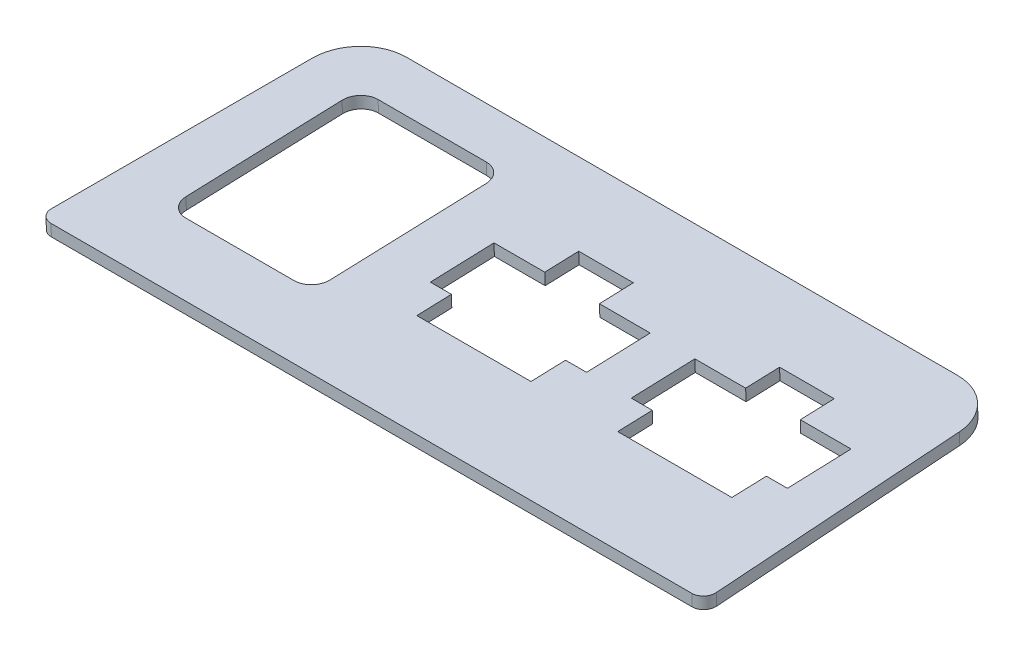
from build123d import *

# Parameters (mm, degrees)
BOSS_EXTRUDE1_DEPTH = 2
CUT_EXTRUDE1_REACH  = 75.082
FILLET1_R           = 2


with BuildPart() as part:
    # Sketch1 → Boss-Extrude1 (new body)
    with BuildSketch(Plane(origin=(0, -69.740385065, -2.435387911), x_dir=(1, 0, 0), z_dir=(0, 0.9993908270190958, 0.03489949670250105))):
        with BuildLine():
            Line((-55.400321558, -4.20689679), (55.400321558, -4.20689679))
            Line((55.400321558, -4.20689679), (53.862501323, 39.830512956))
            ThreePointArc((53.862501323, 39.830512956), (51.42464167, 45.306035386), (45.867374707, 47.551316983))
            Line((45.867374707, 47.551316983), (-45.867374707, 47.551316983))
            ThreePointArc((-45.867374707, 47.551316983), (-51.42464167, 45.306035386), (-53.862501323, 39.830512956))
            Line((-53.862501323, 39.830512956), (-55.400321558, -4.20689679))
        make_face()
    extrude(amount=BOSS_EXTRUDE1_DEPTH)

    # Sketch2 → Cut-Extrude1 (cut, up to next)
    with BuildSketch(Plane(origin=(0, -69.740385065, -2.435387911), x_dir=(1, 0, 0), z_dir=(0, -0.9993908270190958, -0.03489949670250106)), mode=Mode.PRIVATE) as cut_extrude1_sk1:
        Polygon((-4.05, -28.722210096), (-4.05, -34.372210096), (5.05, -34.372210096), (5.05, -28.722210096), (13.5, -28.722210096), (13.5, -18.122210096), (10, -18.122210096), (10, -12.372210096), (-9, -12.372210096), (-9, -18.122210096), (-12.5, -18.122210096), (-12.5, -28.722210096), align=None)
    cut_extrude1_tool1 = extrude(cut_extrude1_sk1.sketch, amount=-CUT_EXTRUDE1_REACH, mode=Mode.PRIVATE) & part.part
    # Sketch2 → Cut-Extrude1 (cut, up to next)
    with BuildSketch(Plane(origin=(0, -69.740385065, -2.435387911), x_dir=(1, 0, 0), z_dir=(0, -0.9993908270190958, -0.03489949670250106)), mode=Mode.PRIVATE) as cut_extrude1_sk2:
        with BuildLine():
            Line((-42.43540929, -7.372210096), (-24.43540929, -7.372210096))
            ThreePointArc((-24.43540929, -7.372210096), (-22.314088947, -8.250889753), (-21.43540929, -10.372210096))
            Line((-21.43540929, -10.372210096), (-21.43540929, -36.372210096))
            ThreePointArc((-21.43540929, -36.372210096), (-22.314088947, -38.49353044), (-24.43540929, -39.372210096))
            Line((-24.43540929, -39.372210096), (-42.43540929, -39.372210096))
            ThreePointArc((-42.43540929, -39.372210096), (-44.556729634, -38.49353044), (-45.43540929, -36.372210096))
            Line((-45.43540929, -36.372210096), (-45.43540929, -10.372210096))
            ThreePointArc((-45.43540929, -10.372210096), (-44.556729634, -8.250889753), (-42.43540929, -7.372210096))
        make_face()
    cut_extrude1_tool2 = extrude(cut_extrude1_sk2.sketch, amount=-CUT_EXTRUDE1_REACH, mode=Mode.PRIVATE) & part.part
    # Sketch2 → Cut-Extrude1 (cut, up to next)
    with BuildSketch(Plane(origin=(0, -69.740385065, -2.435387911), x_dir=(1, 0, 0), z_dir=(0, -0.9993908270190958, -0.03489949670250106)), mode=Mode.PRIVATE) as cut_extrude1_sk3:
        Polygon((29.38540929, -28.722210096), (20.93540929, -28.722210096), (20.93540929, -18.122210096), (24.43540929, -18.122210096), (24.43540929, -12.372210096), (43.43540929, -12.372210096), (43.43540929, -18.122210096), (46.93540929, -18.122210096), (46.93540929, -28.722210096), (38.48540929, -28.722210096), (38.48540929, -34.372210096), (29.38540929, -34.372210096), align=None)
    cut_extrude1_tool3 = extrude(cut_extrude1_sk3.sketch, amount=-CUT_EXTRUDE1_REACH, mode=Mode.PRIVATE) & part.part
    add(cut_extrude1_tool1.solids().sort_by_distance((0.5, -68.96099, -24.754353))[0], mode=Mode.SUBTRACT)
    add(cut_extrude1_tool2.solids().sort_by_distance((-33.435409, -68.924707, -25.79336))[0], mode=Mode.SUBTRACT)
    add(cut_extrude1_tool3.solids().sort_by_distance((33.935409, -68.96099, -24.754353))[0], mode=Mode.SUBTRACT)

    # Fillet1
    fillet1_edges = [part.edges().sort_by_distance(p)[0] for p in [
        (-55.400321558, -68.887812819, 1.803845648),
        (55.400321558, -68.887812819, 1.803845648),
    ]]
    fillet(fillet1_edges, radius=FILLET1_R)


solid = part.part
